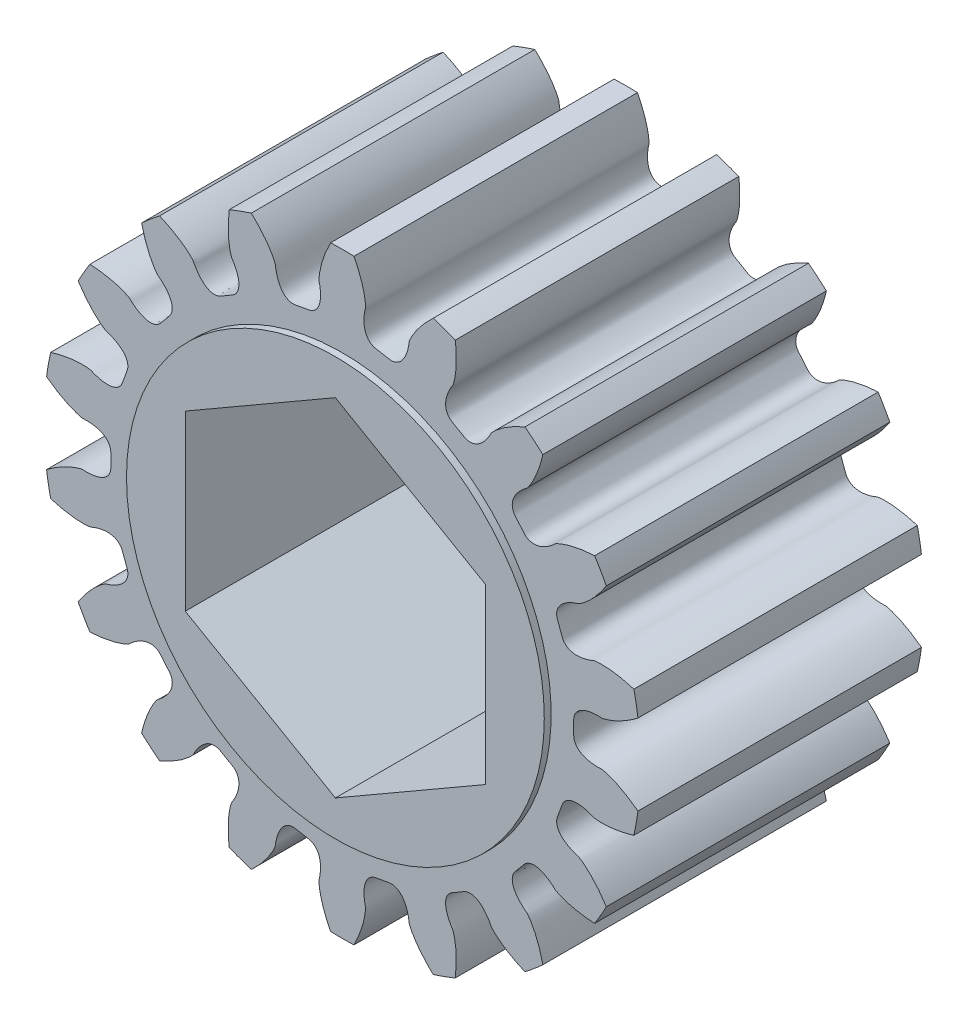
from build123d import *

# Parameters (mm, degrees)
BOSS_EXTRUDE1_DEPTH = 12.065
SKETCH2_R           = 8.89
BOSS_EXTRUDE2_DEPTH = 0.2921
BOSS_EXTRUDE3_START = 0.2921
SKETCH3_R           = 8.89
BOSS_EXTRUDE3_DEPTH = 0.2921
CUT_EXTRUDE1_DEPTH  = 22.900846166


with BuildPart() as part:
    # Sketch1 → Boss-Extrude1 (new body)
    with BuildSketch(Plane.XY.offset(6.0325)):
        with BuildLine():
            ThreePointArc((12.410970883, -2.694030306), (12.507058369, -2.205331838), (12.583910389, -1.713241638))
            add(Edge.make_bspline(
                [(12.583910389, -1.713241638), (12.454495513, -1.615266365), (12.281691884, -1.494600081), (12.063530587, -1.360821083), (11.945634884, -1.293014345), (11.833605036, -1.232708673), (11.727763905, -1.179517154), (11.628417021, -1.133040061), (11.535852234, -1.09286743), (11.450339429, -1.058575143), (11.372129731, -1.029740178), (11.301456539, -1.005894736), (11.238530851, -0.986673766), (11.183554417, -0.971362731), (11.126066888, -0.957744243), (11.037383924, -0.935500863), (10.935383555, -0.952855993), (10.832757273, -0.948980949), (10.755684694, -0.945835715), (10.681454151, -0.939599556), (10.609986165, -0.931080188), (10.541241018, -0.920104184), (10.475144099, -0.906715101), (10.411601978, -0.890856967), (10.350496087, -0.872438809), (10.291684118, -0.851296022), (10.23500406, -0.827170041), (10.180287123, -0.799673241), (10.127386898, -0.768246797), (10.076238411, -0.732113156), (10.026966573, -0.690238537), (9.98006979, -0.641341891), (9.936675165, -0.584030203), (9.898843597, -0.517153755), (9.869552788, -0.440522263), (9.854050846, -0.362318712), (9.847049326, -0.214546824), (9.861767648, -5e-09), (9.847049326, 0.214546814), (9.854050846, 0.362318702), (9.869552789, 0.440522252), (9.898843597, 0.517153744), (9.936675165, 0.584030193), (9.980069791, 0.641341881), (10.026966574, 0.690238527), (10.076238412, 0.732113146), (10.127386899, 0.768246787), (10.180287124, 0.79967323), (10.235004061, 0.82717003), (10.291684119, 0.851296011), (10.350496088, 0.872438798), (10.411601979, 0.890856956), (10.4751441, 0.90671509), (10.541241019, 0.920104174), (10.609986166, 0.931080178), (10.681454152, 0.939599545), (10.755684695, 0.945835704), (10.832757274, 0.948980938), (10.935383556, 0.952855982), (11.037383925, 0.935500852), (11.126066889, 0.957744232), (11.183554418, 0.97136272), (11.238530852, 0.986673755), (11.30145654, 1.005894724), (11.372129732, 1.029740166), (11.45033943, 1.058575132), (11.535852235, 1.092867418), (11.628417022, 1.133040049), (11.727763907, 1.179517142), (11.833605037, 1.23270866), (11.945634885, 1.293014333), (12.063530588, 1.360821071), (12.281691885, 1.494600068), (12.454495515, 1.615266353), (12.58391039, 1.713241625)],
                knots=[0, 0, 0, 0, 0.068568258, 0.088954796, 0.108105787, 0.12602123, 0.142701125, 0.158145472, 0.172354272, 0.185327523, 0.197065227, 0.207567384, 0.216833992, 0.224865053, 0.231660567, 0.241835881, 0.263155637, 0.274398239, 0.285253325, 0.295735543, 0.30586243, 0.315655123, 0.325139277, 0.334346238, 0.343314557, 0.352091904, 0.360737466, 0.369324816, 0.377945084, 0.386709838, 0.395752205, 0.405223204, 0.415278018, 0.42604547, 0.437577809, 0.44979349, 0.459544035, 0.500000005, 0.540455975, 0.550206519, 0.5624222, 0.573954539, 0.584721991, 0.594776805, 0.604247805, 0.613290172, 0.622054925, 0.630675194, 0.639262544, 0.647908106, 0.656685453, 0.665653771, 0.674860733, 0.684344886, 0.69413758, 0.704264467, 0.714746685, 0.725601771, 0.736844372, 0.758164128, 0.768339443, 0.775134956, 0.783166017, 0.792432626, 0.802934782, 0.814672486, 0.827645738, 0.841854537, 0.857298885, 0.87397878, 0.891894222, 0.911045213, 0.931431751, 1.000000005, 1.000000005, 1.000000005, 1.000000005], degree=3))
            ThreePointArc((12.58391039, 1.713241625), (12.507058371, 2.205331832), (12.410970883, 2.694030306))
            add(Edge.make_bspline(
                [(12.410970883, 2.694030306), (12.255851163, 2.741834452), (12.052198568, 2.796121347), (11.801438895, 2.847216926), (11.667461903, 2.870611712), (11.541562526, 2.888964043), (11.423911826, 2.902747921), (11.31466019, 2.912443467), (11.213937893, 2.91853437), (11.121853489, 2.921511477), (11.038498274, 2.921858189), (10.963931576, 2.92009392), (10.898226812, 2.91663387), (10.84132918, 2.912218489), (10.782650776, 2.905353789), (10.691708366, 2.895924368), (10.601795176, 2.8447297), (10.504032672, 2.813270795), (10.430532405, 2.789865973), (10.35864562, 2.770337704), (10.288573885, 2.7538998), (10.220220564, 2.740701645), (10.153530441, 2.730676791), (10.088396577, 2.723845877), (10.024676441, 2.720253838), (9.962180009, 2.720006681), (9.900666605, 2.723291966), (9.839845043, 2.730416211), (9.779386616, 2.741854465), (9.718964327, 2.758315169), (9.658341981, 2.780812478), (9.597549782, 2.810720651), (9.537170421, 2.849734185), (9.478747284, 2.899638332), (9.425013413, 2.961630333), (9.383699162, 3.029815656), (9.326578923, 3.166281147), (9.267030288, 3.372923173), (9.179820255, 3.569497273), (9.13585857, 3.710752086), (9.123678441, 3.789541362), (9.124993284, 3.871569456), (9.137670236, 3.94735192), (9.158846094, 4.016049126), (9.186191017, 4.078036588), (9.218169437, 4.13423782), (9.253874859, 4.185686149), (9.292836333, 4.233310288), (9.334848976, 4.277863123), (9.379859237, 4.319919851), (9.427893151, 4.359902449), (9.479014525, 4.398109302), (9.533300786, 4.434743759), (9.590832237, 4.46993186), (9.651677529, 4.503758155), (9.715921673, 4.536207233), (9.783542674, 4.567455646), (9.854891475, 4.596771573), (9.950003292, 4.63551318), (10.05178809, 4.654090873), (10.127515133, 4.705324173), (10.176877942, 4.737783259), (10.223302209, 4.770973973), (10.275859055, 4.810557629), (10.33411451, 4.85713667), (10.397745447, 4.910981967), (10.466372546, 4.972453278), (10.539615145, 5.041862224), (10.617074577, 5.119515041), (10.698340136, 5.205698517), (10.782988003, 5.300683777), (10.870582454, 5.404723974), (11.029831903, 5.605050669), (11.150943898, 5.777542208), (11.239044585, 5.913871343)],
                knots=[0, 0, 0, 0, 0.068568258, 0.088954796, 0.108105787, 0.12602123, 0.142701125, 0.158145472, 0.172354272, 0.185327523, 0.197065227, 0.207567384, 0.216833992, 0.224865053, 0.231660567, 0.241835881, 0.263155637, 0.274398239, 0.285253325, 0.295735543, 0.30586243, 0.315655123, 0.325139277, 0.334346238, 0.343314557, 0.352091904, 0.360737466, 0.369324816, 0.377945084, 0.386709838, 0.395752205, 0.405223204, 0.415278018, 0.42604547, 0.437577809, 0.44979349, 0.459544035, 0.500000005, 0.540455975, 0.550206519, 0.5624222, 0.573954539, 0.584721991, 0.594776805, 0.604247805, 0.613290172, 0.622054925, 0.630675194, 0.639262544, 0.647908106, 0.656685453, 0.665653771, 0.674860733, 0.684344886, 0.69413758, 0.704264467, 0.714746685, 0.725601771, 0.736844372, 0.758164128, 0.768339443, 0.775134956, 0.783166017, 0.792432626, 0.802934782, 0.814672486, 0.827645738, 0.841854537, 0.857298885, 0.87397878, 0.891894222, 0.911045213, 0.931431751, 1.000000005, 1.000000005, 1.000000005, 1.000000005], degree=3))
            ThreePointArc((11.239044585, 5.913871343), (10.998522549, 6.349999934), (10.741085127, 6.776362423))
            add(Edge.make_bspline(
                [(10.741085127, 6.776362423), (10.57897029, 6.768229557), (10.369032237, 6.749589262), (10.115919506, 6.711838541), (9.982020827, 6.687999619), (9.857437245, 6.662185046), (9.742167386, 6.634898745), (9.636188358, 6.606643318), (9.539457148, 6.57791784), (9.451907882, 6.549220684), (9.373461019, 6.521037324), (9.303994658, 6.493876141), (9.243435784, 6.468152405), (9.191479648, 6.444543168), (9.138687851, 6.418023263), (9.05645499, 6.378058371), (8.989473837, 6.299198996), (8.908366713, 6.23620055), (8.847303975, 6.189068639), (8.786431555, 6.146131341), (8.726207757, 6.106718819), (8.66649068, 6.070938398), (8.607251166, 6.03870875), (8.548381665, 6.010012697), (8.489732872, 5.984843715), (8.431089969, 5.963236424), (8.372162644, 5.945284759), (8.312572436, 5.931177161), (8.251847984, 5.921247604), (8.189439713, 5.916049966), (8.124778809, 5.916456458), (8.057423631, 5.92376879), (7.987342176, 5.939778563), (7.915374162, 5.966691232), (7.843678327, 6.006566591), (7.781534876, 6.05650953), (7.681185462, 6.165208873), (7.554552314, 6.339022027), (7.405369388, 6.49391367), (7.315746925, 6.611613994), (7.277353829, 6.681485846), (7.250534116, 6.759016743), (7.236527426, 6.834564738), (7.232930395, 6.906361566), (7.237425257, 6.97396324), (7.248253188, 7.037712387), (7.264208945, 7.098269976), (7.28453234, 7.156347637), (7.308773343, 7.212582777), (7.336684905, 7.26749759), (7.368147166, 7.321497509), (7.40311803, 7.374884747), (7.441600707, 7.42787687), (7.483627548, 7.480619784), (7.529234146, 7.533216419), (7.578505655, 7.58568137), (7.631361024, 7.638173018), (7.688380328, 7.690123705), (7.764505791, 7.759059064), (7.85379827, 7.811328837), (7.907435592, 7.885372565), (7.942719799, 7.932757203), (7.974992447, 7.979824307), (8.010841319, 8.034996277), (8.04965257, 8.098690797), (8.091029917, 8.171051887), (8.134493868, 8.252287874), (8.17958014, 8.342561393), (8.225809369, 8.442023858), (8.27269753, 8.550804293), (8.319753634, 8.669012516), (8.36648165, 8.796737388), (8.447611417, 9.039449425), (8.502423885, 9.242961193), (8.53858414, 9.401200885)],
                knots=[0, 0, 0, 0, 0.068568258, 0.088954796, 0.108105787, 0.12602123, 0.142701125, 0.158145472, 0.172354272, 0.185327523, 0.197065227, 0.207567384, 0.216833992, 0.224865053, 0.231660567, 0.241835881, 0.263155637, 0.274398239, 0.285253325, 0.295735543, 0.30586243, 0.315655123, 0.325139277, 0.334346238, 0.343314557, 0.352091904, 0.360737466, 0.369324816, 0.377945084, 0.386709838, 0.395752205, 0.405223204, 0.415278018, 0.42604547, 0.437577809, 0.44979349, 0.459544035, 0.500000005, 0.540455975, 0.550206519, 0.5624222, 0.573954539, 0.584721991, 0.594776805, 0.604247805, 0.613290172, 0.622054925, 0.630675194, 0.639262544, 0.647908106, 0.656685453, 0.665653771, 0.674860733, 0.684344886, 0.69413758, 0.704264467, 0.714746685, 0.725601771, 0.736844372, 0.758164128, 0.768339443, 0.775134956, 0.783166017, 0.792432626, 0.802934782, 0.814672486, 0.827645738, 0.841854537, 0.857298885, 0.87397878, 0.891894222, 0.911045213, 0.931431751, 1.000000005, 1.000000005, 1.000000005, 1.000000005], degree=3))
            ThreePointArc((8.53858414, 9.401200885), (8.163402594, 9.728764322), (7.775665989, 10.041365223))
            add(Edge.make_bspline(
                [(7.775665989, 10.041365223), (7.626109477, 9.978276289), (7.435207594, 9.888957098), (7.210270936, 9.766913371), (7.092600726, 9.698716067), (6.984359558, 9.631848209), (6.885373786, 9.56678286), (6.795450001, 9.503984481), (6.714377089, 9.443907339), (6.641922695, 9.386997221), (6.577846033, 9.333683118), (6.521858679, 9.28440106), (6.473749987, 9.2395163), (6.433002025, 9.199560829), (6.392464304, 9.156584413), (6.32885949, 9.090904403), (6.292889289, 8.993891927), (6.238220261, 8.906952482), (6.196960119, 8.841778287), (6.154444176, 8.780610831), (6.111332194, 8.722977423), (6.067454122, 8.668930382), (6.022810376, 8.618383312), (5.977305769, 8.571283288), (5.93080223, 8.527573113), (5.883086055, 8.487211847), (5.833852314, 8.450188467), (5.782680918, 8.41655061), (5.729014708, 8.386450893), (5.672147813, 8.360221825), (5.61124741, 8.338488471), (5.545453281, 8.322322988), (5.47412259, 8.313397984), (5.397290103, 8.31407311), (5.31627988, 8.327022271), (5.240802647, 8.352698971), (5.109327678, 8.42052142), (4.930883844, 8.54054127), (4.737721687, 8.635068239), (4.613248238, 8.715017677), (4.553272948, 8.767544528), (4.501553533, 8.831226859), (4.462552614, 8.897428182), (4.434616549, 8.963664873), (4.415719203, 9.028727002), (4.404090638, 9.092334975), (4.39837223, 9.154697685), (4.397606244, 9.216223845), (4.401151785, 9.277358502), (4.408598102, 9.338507863), (4.419693896, 9.400011916), (4.434296249, 9.462140249), (4.452333762, 9.525098407), (4.473786935, 9.58903456), (4.49865401, 9.654057605), (4.527010014, 9.720210381), (4.558724614, 9.787613996), (4.594537051, 9.855933424), (4.642494306, 9.946747914), (4.708524474, 10.02640526), (4.733602623, 10.114328649), (4.750552431, 10.170923554), (4.764780903, 10.22619006), (4.779597899, 10.290295789), (4.794283736, 10.363423289), (4.808416773, 10.445572357), (4.821475183, 10.536774762), (4.832967058, 10.637024535), (4.842390157, 10.746300007), (4.849245516, 10.864556874), (4.853034196, 10.991730405), (4.853259689, 11.127734447), (4.846484327, 11.383557171), (4.828386074, 11.593542647), (4.808244437, 11.754606853)],
                knots=[0, 0, 0, 0, 0.068568258, 0.088954796, 0.108105787, 0.12602123, 0.142701125, 0.158145472, 0.172354272, 0.185327523, 0.197065227, 0.207567384, 0.216833992, 0.224865053, 0.231660567, 0.241835881, 0.263155637, 0.274398239, 0.285253325, 0.295735543, 0.30586243, 0.315655123, 0.325139277, 0.334346238, 0.343314557, 0.352091904, 0.360737466, 0.369324816, 0.377945084, 0.386709838, 0.395752205, 0.405223204, 0.415278018, 0.42604547, 0.437577809, 0.44979349, 0.459544035, 0.500000005, 0.540455975, 0.550206519, 0.5624222, 0.573954539, 0.584721991, 0.594776805, 0.604247805, 0.613290172, 0.622054925, 0.630675194, 0.639262544, 0.647908106, 0.656685453, 0.665653771, 0.674860733, 0.684344886, 0.69413758, 0.704264467, 0.714746685, 0.725601771, 0.736844372, 0.758164128, 0.768339443, 0.775134956, 0.783166017, 0.792432626, 0.802934782, 0.814672486, 0.827645738, 0.841854537, 0.857298885, 0.87397878, 0.891894222, 0.911045213, 0.931431751, 1.000000005, 1.000000005, 1.000000005, 1.000000005], degree=3))
            ThreePointArc((4.808244437, 11.754606853), (4.343655813, 11.934096152), (3.872386782, 12.095231182))
            add(Edge.make_bspline(
                [(3.872386782, 12.095231182), (3.753427317, 11.984795637), (3.604587189, 11.835570763), (3.434957284, 11.643954305), (3.347708308, 11.53962422), (3.268865036, 11.439768327), (3.198102496, 11.344771771), (3.13508009, 11.255004851), (3.079444065, 11.170822235), (3.030823612, 11.092563355), (2.988845743, 11.020548977), (2.953090296, 10.955090188), (2.923234405, 10.896458169), (2.898609422, 10.844975684), (2.875215224, 10.790726345), (2.837910136, 10.707253197), (2.837289425, 10.603788756), (2.815652384, 10.503394492), (2.799171421, 10.428038982), (2.780140005, 10.356019066), (2.75933978, 10.287116212), (2.736593057, 10.221321422), (2.711929774, 10.158553653), (2.685278587, 10.098730616), (2.656529316, 10.04175134), (2.625495144, 9.987504263), (2.591893302, 9.935874735), (2.555312744, 9.886763841), (2.515177711, 9.840124434), (2.47071118, 9.796027549), (2.420916765, 9.754775711), (2.364619428, 9.717082209), (2.300643036, 9.684298916), (2.228213209, 9.658655068), (2.147659626, 9.643116171), (2.067952278, 9.641429642), (1.921209576, 9.66019481), (1.712478015, 9.711945192), (1.498634835, 9.734706138), (1.354323736, 9.767261608), (1.280000156, 9.796107945), (1.209619164, 9.83826068), (1.150328102, 9.887130474), (1.101422505, 9.939817908), (1.06141225, 9.994493037), (1.028729765, 10.050287777), (1.002026917, 10.106933744), (0.980263939, 10.16448744), (0.962686374, 10.223147873), (0.948769309, 10.283156266), (0.93816032, 10.344746156), (0.930632902, 10.408121991), (0.926049662, 10.4734525), (0.924341599, 10.540870249), (0.925469814, 10.610476965), (0.92949016, 10.682338565), (0.936238741, 10.756524276), (0.946524804, 10.832972114), (0.960529497, 10.934712167), (0.995333141, 11.032149235), (0.988827324, 11.123347427), (0.985398336, 11.182326417), (0.979866467, 11.239126369), (0.971864438, 11.30443376), (0.960653533, 11.378173985), (0.945837607, 11.460202641), (0.92691544, 11.550371108), (0.903426828, 11.648505532), (0.874907232, 11.754413776), (0.840902932, 11.867883553), (0.800967217, 11.988683386), (0.754662989, 12.116562504), (0.660799707, 12.35463992), (0.571973649, 12.545771754), (0.497959499, 12.690233755)],
                knots=[0, 0, 0, 0, 0.068568258, 0.088954796, 0.108105787, 0.12602123, 0.142701125, 0.158145472, 0.172354272, 0.185327523, 0.197065227, 0.207567384, 0.216833992, 0.224865053, 0.231660567, 0.241835881, 0.263155637, 0.274398239, 0.285253325, 0.295735543, 0.30586243, 0.315655123, 0.325139277, 0.334346238, 0.343314557, 0.352091904, 0.360737466, 0.369324816, 0.377945084, 0.386709838, 0.395752205, 0.405223204, 0.415278018, 0.42604547, 0.437577809, 0.44979349, 0.459544035, 0.500000005, 0.540455975, 0.550206519, 0.5624222, 0.573954539, 0.584721991, 0.594776805, 0.604247805, 0.613290172, 0.622054925, 0.630675194, 0.639262544, 0.647908106, 0.656685453, 0.665653771, 0.674860733, 0.684344886, 0.69413758, 0.704264467, 0.714746685, 0.725601771, 0.736844372, 0.758164128, 0.768339443, 0.775134956, 0.783166017, 0.792432626, 0.802934782, 0.814672486, 0.827645738, 0.841854537, 0.857298885, 0.87397878, 0.891894222, 0.911045213, 0.931431751, 1.000000005, 1.000000005, 1.000000005, 1.000000005], degree=3))
            ThreePointArc((0.497959499, 12.690233755), (4.2e-08, 12.699999857), (-0.497959416, 12.690233754))
            add(Edge.make_bspline(
                [(-0.497959416, 12.690233754), (-0.571973566, 12.545771754), (-0.660799623, 12.354639919), (-0.754662905, 12.116562503), (-0.800967133, 11.988683385), (-0.840902847, 11.867883552), (-0.874907148, 11.754413776), (-0.903426744, 11.648505531), (-0.926915355, 11.550371107), (-0.945837523, 11.46020264), (-0.960653449, 11.378173984), (-0.971864354, 11.304433759), (-0.979866382, 11.239126368), (-0.985398251, 11.182326416), (-0.988827239, 11.123347426), (-0.995333057, 11.032149233), (-0.960529412, 10.934712166), (-0.946524718, 10.832972113), (-0.936238656, 10.756524275), (-0.929490075, 10.682338564), (-0.925469729, 10.610476964), (-0.924341513, 10.540870248), (-0.926049577, 10.473452499), (-0.930632816, 10.40812199), (-0.938160235, 10.344746155), (-0.948769224, 10.283156265), (-0.962686288, 10.223147872), (-0.980263854, 10.164487439), (-1.002026831, 10.106933743), (-1.028729679, 10.050287776), (-1.061412164, 9.994493036), (-1.101422419, 9.939817907), (-1.150328016, 9.887130473), (-1.209619078, 9.838260679), (-1.28000007, 9.796107944), (-1.354323649, 9.767261607), (-1.498634749, 9.734706137), (-1.712477929, 9.71194519), (-1.92120949, 9.660194808), (-2.067952192, 9.64142964), (-2.147659539, 9.643116169), (-2.228213122, 9.658655066), (-2.30064295, 9.684298913), (-2.364619342, 9.717082207), (-2.420916679, 9.754775709), (-2.470711094, 9.796027546), (-2.515177625, 9.840124431), (-2.555312658, 9.886763838), (-2.591893216, 9.935874733), (-2.625495058, 9.987504261), (-2.65652923, 10.041751337), (-2.685278501, 10.098730613), (-2.711929688, 10.158553651), (-2.736592971, 10.221321419), (-2.759339694, 10.287116209), (-2.78013992, 10.356019063), (-2.799171336, 10.42803898), (-2.815652299, 10.503394489), (-2.837289339, 10.603788753), (-2.837910051, 10.707253194), (-2.875215139, 10.790726342), (-2.898609336, 10.844975681), (-2.92323432, 10.896458166), (-2.953090211, 10.955090185), (-2.988845658, 11.020548974), (-3.030823527, 11.092563352), (-3.07944398, 11.170822232), (-3.135080005, 11.255004848), (-3.198102412, 11.344771768), (-3.268864951, 11.439768323), (-3.347708224, 11.539624216), (-3.434957199, 11.643954302), (-3.604587105, 11.835570759), (-3.753427233, 11.984795633), (-3.872386698, 12.095231178)],
                knots=[0, 0, 0, 0, 0.068568258, 0.088954796, 0.108105787, 0.12602123, 0.142701125, 0.158145472, 0.172354272, 0.185327523, 0.197065227, 0.207567384, 0.216833992, 0.224865053, 0.231660567, 0.241835881, 0.263155637, 0.274398239, 0.285253325, 0.295735543, 0.30586243, 0.315655123, 0.325139277, 0.334346238, 0.343314557, 0.352091904, 0.360737466, 0.369324816, 0.377945084, 0.386709838, 0.395752205, 0.405223204, 0.415278018, 0.42604547, 0.437577809, 0.44979349, 0.459544035, 0.500000005, 0.540455975, 0.550206519, 0.5624222, 0.573954539, 0.584721991, 0.594776805, 0.604247805, 0.613290172, 0.622054925, 0.630675194, 0.639262544, 0.647908106, 0.656685453, 0.665653771, 0.674860733, 0.684344886, 0.69413758, 0.704264467, 0.714746685, 0.725601771, 0.736844372, 0.758164128, 0.768339443, 0.775134956, 0.783166017, 0.792432626, 0.802934782, 0.814672486, 0.827645738, 0.841854537, 0.857298885, 0.87397878, 0.891894222, 0.911045213, 0.931431751, 1.000000005, 1.000000005, 1.000000005, 1.000000005], degree=3))
            ThreePointArc((-3.872386698, 12.095231178), (-4.343655729, 11.934096147), (-4.808244353, 11.754606848))
            add(Edge.make_bspline(
                [(-4.808244353, 11.754606848), (-4.82838599, 11.593542642), (-4.846484243, 11.383557166), (-4.853259604, 11.127734442), (-4.853034111, 10.9917304), (-4.849245431, 10.864556869), (-4.842390072, 10.746300002), (-4.832966973, 10.63702453), (-4.821475098, 10.536774757), (-4.808416687, 10.445572352), (-4.794283651, 10.363423284), (-4.779597813, 10.290295784), (-4.764780817, 10.226190055), (-4.750552345, 10.170923549), (-4.733602538, 10.114328644), (-4.708524388, 10.026405255), (-4.64249422, 9.946747909), (-4.594536965, 9.855933419), (-4.558724527, 9.787613991), (-4.527009928, 9.720210376), (-4.498653924, 9.6540576), (-4.473786849, 9.589034555), (-4.452333676, 9.525098402), (-4.434296162, 9.462140244), (-4.419693809, 9.400011911), (-4.408598015, 9.338507859), (-4.401151699, 9.277358498), (-4.397606157, 9.21622384), (-4.398372143, 9.15469768), (-4.404090551, 9.092334971), (-4.415719116, 9.028726997), (-4.434616462, 8.963664869), (-4.462552527, 8.897428177), (-4.501553446, 8.831226854), (-4.553272861, 8.767544524), (-4.613248151, 8.715017672), (-4.7377216, 8.635068234), (-4.930883756, 8.540541265), (-5.109327591, 8.420521415), (-5.240802559, 8.352698965), (-5.316279792, 8.327022266), (-5.397290015, 8.314073104), (-5.474122503, 8.313397978), (-5.545453193, 8.322322982), (-5.611247322, 8.338488465), (-5.672147725, 8.360221819), (-5.72901462, 8.386450887), (-5.78268083, 8.416550604), (-5.833852226, 8.450188461), (-5.883085968, 8.487211841), (-5.930802143, 8.527573107), (-5.977305681, 8.571283282), (-6.022810289, 8.618383306), (-6.067454035, 8.668930375), (-6.111332106, 8.722977417), (-6.154444089, 8.780610824), (-6.196960032, 8.84177828), (-6.238220174, 8.906952475), (-6.292889201, 8.993891921), (-6.328859403, 9.090904397), (-6.392464217, 9.156584406), (-6.433001938, 9.199560823), (-6.4737499, 9.239516293), (-6.521858592, 9.284401053), (-6.577845946, 9.333683111), (-6.641922608, 9.386997214), (-6.714377002, 9.443907332), (-6.795449914, 9.503984474), (-6.8853737, 9.566782853), (-6.984359472, 9.631848201), (-7.09260064, 9.69871606), (-7.210270849, 9.766913364), (-7.435207508, 9.88895709), (-7.626109391, 9.978276281), (-7.775665903, 10.041365215)],
                knots=[0, 0, 0, 0, 0.068568258, 0.088954796, 0.108105787, 0.12602123, 0.142701125, 0.158145472, 0.172354272, 0.185327523, 0.197065227, 0.207567384, 0.216833992, 0.224865053, 0.231660567, 0.241835881, 0.263155637, 0.274398239, 0.285253325, 0.295735543, 0.30586243, 0.315655123, 0.325139277, 0.334346238, 0.343314557, 0.352091904, 0.360737466, 0.369324816, 0.377945084, 0.386709838, 0.395752205, 0.405223204, 0.415278018, 0.42604547, 0.437577809, 0.44979349, 0.459544035, 0.500000005, 0.540455975, 0.550206519, 0.5624222, 0.573954539, 0.584721991, 0.594776805, 0.604247805, 0.613290172, 0.622054925, 0.630675194, 0.639262544, 0.647908106, 0.656685453, 0.665653771, 0.674860733, 0.684344886, 0.69413758, 0.704264467, 0.714746685, 0.725601771, 0.736844372, 0.758164128, 0.768339443, 0.775134956, 0.783166017, 0.792432626, 0.802934782, 0.814672486, 0.827645738, 0.841854537, 0.857298885, 0.87397878, 0.891894222, 0.911045213, 0.931431751, 1.000000005, 1.000000005, 1.000000005, 1.000000005], degree=3))
            ThreePointArc((-7.775665903, 10.041365215), (-8.163402508, 9.728764314), (-8.538584053, 9.401200876))
            add(Edge.make_bspline(
                [(-8.538584053, 9.401200876), (-8.502423798, 9.242961184), (-8.44761133, 9.039449416), (-8.366481563, 8.79673738), (-8.319753546, 8.669012508), (-8.272697442, 8.550804284), (-8.225809282, 8.44202385), (-8.179580052, 8.342561384), (-8.13449378, 8.252287866), (-8.091029829, 8.171051878), (-8.049652482, 8.098690788), (-8.010841231, 8.034996268), (-7.974992359, 7.979824299), (-7.942719711, 7.932757195), (-7.907435504, 7.885372557), (-7.853798181, 7.811328829), (-7.764505703, 7.759059056), (-7.68838024, 7.690123697), (-7.631360936, 7.63817301), (-7.578505567, 7.585681362), (-7.529234057, 7.533216411), (-7.483627459, 7.480619776), (-7.441600618, 7.427876863), (-7.403117941, 7.374884739), (-7.368147077, 7.321497502), (-7.336684816, 7.267497582), (-7.308773254, 7.21258277), (-7.284532251, 7.15634763), (-7.264208856, 7.098269968), (-7.248253099, 7.03771238), (-7.237425168, 6.973963233), (-7.232930305, 6.906361558), (-7.236527337, 6.834564731), (-7.250534027, 6.759016736), (-7.277353739, 6.681485838), (-7.315746836, 6.611613986), (-7.405369299, 6.493913663), (-7.554552225, 6.339022019), (-7.681185372, 6.165208865), (-7.781534786, 6.056509522), (-7.843678237, 6.006566583), (-7.915374072, 5.966691223), (-7.987342086, 5.939778555), (-8.057423541, 5.923768782), (-8.124778719, 5.916456449), (-8.189439623, 5.916049957), (-8.251847894, 5.921247596), (-8.312572346, 5.931177152), (-8.372162554, 5.94528475), (-8.431089879, 5.963236416), (-8.489732782, 5.984843706), (-8.548381574, 6.010012688), (-8.607251076, 6.038708741), (-8.66649059, 6.070938389), (-8.726207667, 6.10671881), (-8.786431465, 6.146131332), (-8.847303885, 6.18906863), (-8.908366623, 6.236200541), (-8.989473747, 6.299198987), (-9.056454901, 6.378058361), (-9.138687761, 6.418023254), (-9.191479559, 6.444543158), (-9.243435694, 6.468152395), (-9.303994569, 6.493876131), (-9.373460929, 6.521037315), (-9.451907792, 6.549220675), (-9.539457058, 6.57791783), (-9.636188269, 6.606643308), (-9.742167297, 6.634898735), (-9.857437156, 6.662185035), (-9.982020738, 6.687999609), (-10.115919417, 6.71183853), (-10.369032148, 6.749589251), (-10.578970201, 6.768229546), (-10.741085038, 6.776362412)],
                knots=[0, 0, 0, 0, 0.068568258, 0.088954796, 0.108105787, 0.12602123, 0.142701125, 0.158145472, 0.172354272, 0.185327523, 0.197065227, 0.207567384, 0.216833992, 0.224865053, 0.231660567, 0.241835881, 0.263155637, 0.274398239, 0.285253325, 0.295735543, 0.30586243, 0.315655123, 0.325139277, 0.334346238, 0.343314557, 0.352091904, 0.360737466, 0.369324816, 0.377945084, 0.386709838, 0.395752205, 0.405223204, 0.415278018, 0.42604547, 0.437577809, 0.44979349, 0.459544035, 0.500000005, 0.540455975, 0.550206519, 0.5624222, 0.573954539, 0.584721991, 0.594776805, 0.604247805, 0.613290172, 0.622054925, 0.630675194, 0.639262544, 0.647908106, 0.656685453, 0.665653771, 0.674860733, 0.684344886, 0.69413758, 0.704264467, 0.714746685, 0.725601771, 0.736844372, 0.758164128, 0.768339443, 0.775134956, 0.783166017, 0.792432626, 0.802934782, 0.814672486, 0.827645738, 0.841854537, 0.857298885, 0.87397878, 0.891894222, 0.911045213, 0.931431751, 1.000000005, 1.000000005, 1.000000005, 1.000000005], degree=3))
            ThreePointArc((-10.741085038, 6.776362412), (-10.998522459, 6.349999923), (-11.239044495, 5.913871331))
            add(Edge.make_bspline(
                [(-11.239044495, 5.913871331), (-11.150943808, 5.777542197), (-11.029831812, 5.605050658), (-10.870582363, 5.404723963), (-10.782987912, 5.300683766), (-10.698340045, 5.205698506), (-10.617074486, 5.11951503), (-10.539615054, 5.041862213), (-10.466372455, 4.972453267), (-10.397745356, 4.910981956), (-10.334114419, 4.85713666), (-10.275858964, 4.810557619), (-10.223302118, 4.770973963), (-10.176877851, 4.737783248), (-10.127515041, 4.705324163), (-10.051787999, 4.654090863), (-9.950003201, 4.635513169), (-9.854891383, 4.596771563), (-9.783542583, 4.567455636), (-9.715921582, 4.536207223), (-9.651677437, 4.503758145), (-9.590832145, 4.46993185), (-9.533300694, 4.434743749), (-9.479014433, 4.398109293), (-9.427893059, 4.35990244), (-9.379859145, 4.319919841), (-9.334848884, 4.277863113), (-9.292836241, 4.233310278), (-9.253874767, 4.185686139), (-9.218169345, 4.13423781), (-9.186190925, 4.078036578), (-9.158846002, 4.016049116), (-9.137670144, 3.94735191), (-9.124993192, 3.871569447), (-9.123678349, 3.789541353), (-9.135858477, 3.710752077), (-9.179820163, 3.569497263), (-9.267030195, 3.372923163), (-9.32657883, 3.166281138), (-9.383699069, 3.029815646), (-9.42501332, 2.961630323), (-9.47874719, 2.899638322), (-9.537170328, 2.849734175), (-9.597549689, 2.810720641), (-9.658341887, 2.780812468), (-9.718964234, 2.758315159), (-9.779386522, 2.741854455), (-9.83984495, 2.730416201), (-9.900666511, 2.723291955), (-9.962179915, 2.720006671), (-10.024676347, 2.720253828), (-10.088396483, 2.723845866), (-10.153530347, 2.73067678), (-10.220220471, 2.740701635), (-10.288573792, 2.75389979), (-10.358645527, 2.770337694), (-10.430532312, 2.789865962), (-10.504032579, 2.813270784), (-10.601795082, 2.844729689), (-10.691708273, 2.895924358), (-10.782650683, 2.905353778), (-10.841329087, 2.912218478), (-10.898226719, 2.916633859), (-10.963931482, 2.920093908), (-11.03849818, 2.921858178), (-11.121853396, 2.921511465), (-11.2139378, 2.918534358), (-11.314660097, 2.912443455), (-11.423911733, 2.90274791), (-11.541562433, 2.888964031), (-11.667461809, 2.8706117), (-11.801438801, 2.847216914), (-12.052198474, 2.796121335), (-12.25585107, 2.74183444), (-12.41097079, 2.694030294)],
                knots=[0, 0, 0, 0, 0.068568258, 0.088954796, 0.108105787, 0.12602123, 0.142701125, 0.158145472, 0.172354272, 0.185327523, 0.197065227, 0.207567384, 0.216833992, 0.224865053, 0.231660567, 0.241835881, 0.263155637, 0.274398239, 0.285253325, 0.295735543, 0.30586243, 0.315655123, 0.325139277, 0.334346238, 0.343314557, 0.352091904, 0.360737466, 0.369324816, 0.377945084, 0.386709838, 0.395752205, 0.405223204, 0.415278018, 0.42604547, 0.437577809, 0.44979349, 0.459544035, 0.500000005, 0.540455975, 0.550206519, 0.5624222, 0.573954539, 0.584721991, 0.594776805, 0.604247805, 0.613290172, 0.622054925, 0.630675194, 0.639262544, 0.647908106, 0.656685453, 0.665653771, 0.674860733, 0.684344886, 0.69413758, 0.704264467, 0.714746685, 0.725601771, 0.736844372, 0.758164128, 0.768339443, 0.775134956, 0.783166017, 0.792432626, 0.802934782, 0.814672486, 0.827645738, 0.841854537, 0.857298885, 0.87397878, 0.891894222, 0.911045213, 0.931431751, 1.000000005, 1.000000005, 1.000000005, 1.000000005], degree=3))
            ThreePointArc((-12.41097079, 2.694030294), (-12.507058275, 2.205331828), (-12.583910293, 1.713241631))
            add(Edge.make_bspline(
                [(-12.583910293, 1.713241631), (-12.454495418, 1.615266359), (-12.281691788, 1.494600075), (-12.063530491, 1.360821077), (-11.945634789, 1.293014339), (-11.83360494, 1.232708667), (-11.72776381, 1.179517148), (-11.628416925, 1.133040055), (-11.535852138, 1.092867424), (-11.450339333, 1.058575137), (-11.372129635, 1.029740172), (-11.301456443, 1.00589473), (-11.238530755, 0.986673761), (-11.183554321, 0.971362725), (-11.126066792, 0.957744237), (-11.037383829, 0.935500858), (-10.93538346, 0.952855987), (-10.832757177, 0.948980943), (-10.755684598, 0.94583571), (-10.681454055, 0.939599551), (-10.609986069, 0.931080183), (-10.541240923, 0.920104179), (-10.475144003, 0.906715096), (-10.411601882, 0.890856962), (-10.350495991, 0.872438803), (-10.291684022, 0.851296017), (-10.235003964, 0.827170036), (-10.180287027, 0.799673236), (-10.127386802, 0.768246792), (-10.076238316, 0.732113151), (-10.026966477, 0.690238532), (-9.980069694, 0.641341886), (-9.936675069, 0.584030198), (-9.898843501, 0.51715375), (-9.869552692, 0.440522258), (-9.85405075, 0.362318707), (-9.84704923, 0.214546819), (-9.861767552, 0), (-9.84704923, -0.214546819), (-9.85405075, -0.362318707), (-9.869552692, -0.440522258), (-9.898843501, -0.51715375), (-9.936675069, -0.584030198), (-9.980069694, -0.641341886), (-10.026966477, -0.690238532), (-10.076238316, -0.732113151), (-10.127386802, -0.768246792), (-10.180287027, -0.799673236), (-10.235003964, -0.827170036), (-10.291684022, -0.851296017), (-10.350495991, -0.872438803), (-10.411601882, -0.890856962), (-10.475144003, -0.906715096), (-10.541240923, -0.920104179), (-10.609986069, -0.931080183), (-10.681454055, -0.939599551), (-10.755684598, -0.94583571), (-10.832757177, -0.948980943), (-10.93538346, -0.952855987), (-11.037383829, -0.935500858), (-11.126066792, -0.957744237), (-11.183554321, -0.971362725), (-11.238530755, -0.986673761), (-11.301456443, -1.00589473), (-11.372129635, -1.029740172), (-11.450339333, -1.058575137), (-11.535852138, -1.092867424), (-11.628416925, -1.133040055), (-11.72776381, -1.179517148), (-11.83360494, -1.232708667), (-11.945634789, -1.293014339), (-12.063530491, -1.360821077), (-12.281691788, -1.494600075), (-12.454495418, -1.615266359), (-12.583910293, -1.713241631)],
                knots=[0, 0, 0, 0, 0.068568258, 0.088954796, 0.108105787, 0.12602123, 0.142701125, 0.158145472, 0.172354272, 0.185327523, 0.197065227, 0.207567384, 0.216833992, 0.224865053, 0.231660567, 0.241835881, 0.263155637, 0.274398239, 0.285253325, 0.295735543, 0.30586243, 0.315655123, 0.325139277, 0.334346238, 0.343314557, 0.352091904, 0.360737466, 0.369324816, 0.377945084, 0.386709838, 0.395752205, 0.405223204, 0.415278018, 0.42604547, 0.437577809, 0.44979349, 0.459544035, 0.500000005, 0.540455975, 0.550206519, 0.5624222, 0.573954539, 0.584721991, 0.594776805, 0.604247805, 0.613290172, 0.622054925, 0.630675194, 0.639262544, 0.647908106, 0.656685453, 0.665653771, 0.674860733, 0.684344886, 0.69413758, 0.704264467, 0.714746685, 0.725601771, 0.736844372, 0.758164128, 0.768339443, 0.775134956, 0.783166017, 0.792432626, 0.802934782, 0.814672486, 0.827645738, 0.841854537, 0.857298885, 0.87397878, 0.891894222, 0.911045213, 0.931431751, 1.000000005, 1.000000005, 1.000000005, 1.000000005], degree=3))
            ThreePointArc((-12.583910293, -1.713241631), (-12.507058275, -2.205331828), (-12.41097079, -2.694030294))
            add(Edge.make_bspline(
                [(-12.41097079, -2.694030294), (-12.25585107, -2.74183444), (-12.052198474, -2.796121335), (-11.801438801, -2.847216914), (-11.667461809, -2.8706117), (-11.541562433, -2.888964031), (-11.423911733, -2.90274791), (-11.314660097, -2.912443455), (-11.2139378, -2.918534358), (-11.121853396, -2.921511465), (-11.03849818, -2.921858178), (-10.963931482, -2.920093908), (-10.898226719, -2.916633859), (-10.841329087, -2.912218478), (-10.782650683, -2.905353778), (-10.691708273, -2.895924358), (-10.601795082, -2.844729689), (-10.504032579, -2.813270784), (-10.430532312, -2.789865962), (-10.358645527, -2.770337694), (-10.288573792, -2.75389979), (-10.220220471, -2.740701635), (-10.153530347, -2.73067678), (-10.088396483, -2.723845866), (-10.024676347, -2.720253828), (-9.962179915, -2.720006671), (-9.900666511, -2.723291955), (-9.83984495, -2.730416201), (-9.779386522, -2.741854455), (-9.718964234, -2.758315159), (-9.658341887, -2.780812468), (-9.597549689, -2.810720641), (-9.537170328, -2.849734175), (-9.47874719, -2.899638322), (-9.42501332, -2.961630323), (-9.383699069, -3.029815646), (-9.32657883, -3.166281138), (-9.267030195, -3.372923163), (-9.179820163, -3.569497263), (-9.135858477, -3.710752077), (-9.123678349, -3.789541353), (-9.124993192, -3.871569447), (-9.137670144, -3.94735191), (-9.158846002, -4.016049116), (-9.186190925, -4.078036578), (-9.218169345, -4.13423781), (-9.253874767, -4.185686139), (-9.292836241, -4.233310278), (-9.334848884, -4.277863113), (-9.379859145, -4.319919841), (-9.427893059, -4.35990244), (-9.479014433, -4.398109293), (-9.533300694, -4.434743749), (-9.590832145, -4.46993185), (-9.651677437, -4.503758145), (-9.715921582, -4.536207223), (-9.783542583, -4.567455636), (-9.854891383, -4.596771563), (-9.950003201, -4.635513169), (-10.051787999, -4.654090863), (-10.127515041, -4.705324163), (-10.176877851, -4.737783248), (-10.223302118, -4.770973963), (-10.275858964, -4.810557619), (-10.334114419, -4.85713666), (-10.397745356, -4.910981956), (-10.466372455, -4.972453267), (-10.539615054, -5.041862213), (-10.617074486, -5.11951503), (-10.698340045, -5.205698506), (-10.782987912, -5.300683766), (-10.870582363, -5.404723963), (-11.029831812, -5.605050658), (-11.150943808, -5.777542197), (-11.239044495, -5.913871331)],
                knots=[0, 0, 0, 0, 0.068568258, 0.088954796, 0.108105787, 0.12602123, 0.142701125, 0.158145472, 0.172354272, 0.185327523, 0.197065227, 0.207567384, 0.216833992, 0.224865053, 0.231660567, 0.241835881, 0.263155637, 0.274398239, 0.285253325, 0.295735543, 0.30586243, 0.315655123, 0.325139277, 0.334346238, 0.343314557, 0.352091904, 0.360737466, 0.369324816, 0.377945084, 0.386709838, 0.395752205, 0.405223204, 0.415278018, 0.42604547, 0.437577809, 0.44979349, 0.459544035, 0.500000005, 0.540455975, 0.550206519, 0.5624222, 0.573954539, 0.584721991, 0.594776805, 0.604247805, 0.613290172, 0.622054925, 0.630675194, 0.639262544, 0.647908106, 0.656685453, 0.665653771, 0.674860733, 0.684344886, 0.69413758, 0.704264467, 0.714746685, 0.725601771, 0.736844372, 0.758164128, 0.768339443, 0.775134956, 0.783166017, 0.792432626, 0.802934782, 0.814672486, 0.827645738, 0.841854537, 0.857298885, 0.87397878, 0.891894222, 0.911045213, 0.931431751, 1.000000005, 1.000000005, 1.000000005, 1.000000005], degree=3))
            ThreePointArc((-11.239044495, -5.913871331), (-10.998522459, -6.349999923), (-10.741085038, -6.776362412))
            add(Edge.make_bspline(
                [(-10.741085038, -6.776362412), (-10.578970201, -6.768229546), (-10.369032148, -6.749589251), (-10.115919417, -6.71183853), (-9.982020738, -6.687999609), (-9.857437156, -6.662185035), (-9.742167297, -6.634898735), (-9.636188269, -6.606643308), (-9.539457058, -6.57791783), (-9.451907792, -6.549220675), (-9.373460929, -6.521037315), (-9.303994569, -6.493876131), (-9.243435694, -6.468152395), (-9.191479559, -6.444543158), (-9.138687761, -6.418023254), (-9.056454901, -6.378058361), (-8.989473747, -6.299198987), (-8.908366623, -6.236200541), (-8.847303885, -6.18906863), (-8.786431465, -6.146131332), (-8.726207667, -6.10671881), (-8.66649059, -6.070938389), (-8.607251076, -6.038708741), (-8.548381574, -6.010012688), (-8.489732782, -5.984843706), (-8.431089879, -5.963236416), (-8.372162554, -5.94528475), (-8.312572346, -5.931177152), (-8.251847894, -5.921247596), (-8.189439623, -5.916049957), (-8.124778719, -5.916456449), (-8.057423541, -5.923768782), (-7.987342086, -5.939778555), (-7.915374072, -5.966691223), (-7.843678237, -6.006566583), (-7.781534786, -6.056509522), (-7.681185372, -6.165208865), (-7.554552225, -6.339022019), (-7.405369299, -6.493913663), (-7.315746836, -6.611613986), (-7.277353739, -6.681485838), (-7.250534027, -6.759016736), (-7.236527337, -6.834564731), (-7.232930305, -6.906361558), (-7.237425168, -6.973963233), (-7.248253099, -7.03771238), (-7.264208856, -7.098269968), (-7.284532251, -7.15634763), (-7.308773254, -7.21258277), (-7.336684816, -7.267497582), (-7.368147077, -7.321497502), (-7.403117941, -7.374884739), (-7.441600618, -7.427876863), (-7.483627459, -7.480619776), (-7.529234057, -7.533216411), (-7.578505567, -7.585681362), (-7.631360936, -7.63817301), (-7.68838024, -7.690123697), (-7.764505703, -7.759059056), (-7.853798181, -7.811328829), (-7.907435504, -7.885372557), (-7.942719711, -7.932757195), (-7.974992359, -7.979824299), (-8.010841231, -8.034996268), (-8.049652482, -8.098690788), (-8.091029829, -8.171051878), (-8.13449378, -8.252287866), (-8.179580052, -8.342561384), (-8.225809282, -8.44202385), (-8.272697442, -8.550804284), (-8.319753546, -8.669012508), (-8.366481563, -8.79673738), (-8.44761133, -9.039449416), (-8.502423798, -9.242961184), (-8.538584053, -9.401200876)],
                knots=[0, 0, 0, 0, 0.068568258, 0.088954796, 0.108105787, 0.12602123, 0.142701125, 0.158145472, 0.172354272, 0.185327523, 0.197065227, 0.207567384, 0.216833992, 0.224865053, 0.231660567, 0.241835881, 0.263155637, 0.274398239, 0.285253325, 0.295735543, 0.30586243, 0.315655123, 0.325139277, 0.334346238, 0.343314557, 0.352091904, 0.360737466, 0.369324816, 0.377945084, 0.386709838, 0.395752205, 0.405223204, 0.415278018, 0.42604547, 0.437577809, 0.44979349, 0.459544035, 0.500000005, 0.540455975, 0.550206519, 0.5624222, 0.573954539, 0.584721991, 0.594776805, 0.604247805, 0.613290172, 0.622054925, 0.630675194, 0.639262544, 0.647908106, 0.656685453, 0.665653771, 0.674860733, 0.684344886, 0.69413758, 0.704264467, 0.714746685, 0.725601771, 0.736844372, 0.758164128, 0.768339443, 0.775134956, 0.783166017, 0.792432626, 0.802934782, 0.814672486, 0.827645738, 0.841854537, 0.857298885, 0.87397878, 0.891894222, 0.911045213, 0.931431751, 1.000000005, 1.000000005, 1.000000005, 1.000000005], degree=3))
            ThreePointArc((-8.538584053, -9.401200876), (-8.163402508, -9.728764314), (-7.775665903, -10.041365215))
            add(Edge.make_bspline(
                [(-7.775665903, -10.041365215), (-7.626109391, -9.978276281), (-7.435207508, -9.88895709), (-7.210270849, -9.766913364), (-7.09260064, -9.69871606), (-6.984359472, -9.631848201), (-6.8853737, -9.566782853), (-6.795449914, -9.503984474), (-6.714377002, -9.443907332), (-6.641922608, -9.386997214), (-6.577845946, -9.333683111), (-6.521858592, -9.284401053), (-6.4737499, -9.239516293), (-6.433001938, -9.199560823), (-6.392464217, -9.156584406), (-6.328859403, -9.090904397), (-6.292889201, -8.993891921), (-6.238220174, -8.906952475), (-6.196960032, -8.84177828), (-6.154444089, -8.780610824), (-6.111332106, -8.722977417), (-6.067454035, -8.668930375), (-6.022810289, -8.618383306), (-5.977305681, -8.571283282), (-5.930802143, -8.527573107), (-5.883085968, -8.487211841), (-5.833852226, -8.450188461), (-5.78268083, -8.416550604), (-5.72901462, -8.386450887), (-5.672147725, -8.360221819), (-5.611247322, -8.338488465), (-5.545453193, -8.322322982), (-5.474122503, -8.313397978), (-5.397290015, -8.314073104), (-5.316279792, -8.327022266), (-5.240802559, -8.352698965), (-5.109327591, -8.420521415), (-4.930883756, -8.540541265), (-4.7377216, -8.635068234), (-4.613248151, -8.715017672), (-4.553272861, -8.767544524), (-4.501553446, -8.831226854), (-4.462552527, -8.897428177), (-4.434616462, -8.963664869), (-4.415719116, -9.028726997), (-4.404090551, -9.092334971), (-4.398372143, -9.15469768), (-4.397606157, -9.21622384), (-4.401151699, -9.277358498), (-4.408598015, -9.338507859), (-4.419693809, -9.400011911), (-4.434296162, -9.462140244), (-4.452333676, -9.525098402), (-4.473786849, -9.589034555), (-4.498653924, -9.6540576), (-4.527009928, -9.720210376), (-4.558724527, -9.787613991), (-4.594536965, -9.855933419), (-4.64249422, -9.946747909), (-4.708524388, -10.026405255), (-4.733602538, -10.114328644), (-4.750552345, -10.170923549), (-4.764780817, -10.226190055), (-4.779597813, -10.290295784), (-4.794283651, -10.363423284), (-4.808416687, -10.445572352), (-4.821475098, -10.536774757), (-4.832966973, -10.63702453), (-4.842390072, -10.746300002), (-4.849245431, -10.864556869), (-4.853034111, -10.9917304), (-4.853259604, -11.127734442), (-4.846484243, -11.383557166), (-4.82838599, -11.593542642), (-4.808244353, -11.754606848)],
                knots=[0, 0, 0, 0, 0.068568258, 0.088954796, 0.108105787, 0.12602123, 0.142701125, 0.158145472, 0.172354272, 0.185327523, 0.197065227, 0.207567384, 0.216833992, 0.224865053, 0.231660567, 0.241835881, 0.263155637, 0.274398239, 0.285253325, 0.295735543, 0.30586243, 0.315655123, 0.325139277, 0.334346238, 0.343314557, 0.352091904, 0.360737466, 0.369324816, 0.377945084, 0.386709838, 0.395752205, 0.405223204, 0.415278018, 0.42604547, 0.437577809, 0.44979349, 0.459544035, 0.500000005, 0.540455975, 0.550206519, 0.5624222, 0.573954539, 0.584721991, 0.594776805, 0.604247805, 0.613290172, 0.622054925, 0.630675194, 0.639262544, 0.647908106, 0.656685453, 0.665653771, 0.674860733, 0.684344886, 0.69413758, 0.704264467, 0.714746685, 0.725601771, 0.736844372, 0.758164128, 0.768339443, 0.775134956, 0.783166017, 0.792432626, 0.802934782, 0.814672486, 0.827645738, 0.841854537, 0.857298885, 0.87397878, 0.891894222, 0.911045213, 0.931431751, 1.000000005, 1.000000005, 1.000000005, 1.000000005], degree=3))
            ThreePointArc((-4.808244353, -11.754606848), (-4.343655729, -11.934096147), (-3.872386698, -12.095231178))
            add(Edge.make_bspline(
                [(-3.872386698, -12.095231178), (-3.753427233, -11.984795633), (-3.604587105, -11.835570759), (-3.434957199, -11.643954302), (-3.347708224, -11.539624216), (-3.268864951, -11.439768323), (-3.198102412, -11.344771768), (-3.135080005, -11.255004848), (-3.07944398, -11.170822232), (-3.030823527, -11.092563352), (-2.988845658, -11.020548974), (-2.953090211, -10.955090185), (-2.92323432, -10.896458166), (-2.898609336, -10.844975681), (-2.875215139, -10.790726342), (-2.837910051, -10.707253194), (-2.837289339, -10.603788753), (-2.815652299, -10.503394489), (-2.799171336, -10.42803898), (-2.78013992, -10.356019063), (-2.759339694, -10.287116209), (-2.736592971, -10.221321419), (-2.711929688, -10.158553651), (-2.685278501, -10.098730613), (-2.65652923, -10.041751337), (-2.625495058, -9.987504261), (-2.591893216, -9.935874733), (-2.555312658, -9.886763838), (-2.515177625, -9.840124431), (-2.470711094, -9.796027546), (-2.420916679, -9.754775709), (-2.364619342, -9.717082207), (-2.30064295, -9.684298913), (-2.228213122, -9.658655066), (-2.147659539, -9.643116169), (-2.067952192, -9.64142964), (-1.92120949, -9.660194808), (-1.712477929, -9.71194519), (-1.498634749, -9.734706137), (-1.354323649, -9.767261607), (-1.28000007, -9.796107944), (-1.209619078, -9.838260679), (-1.150328016, -9.887130473), (-1.101422419, -9.939817907), (-1.061412164, -9.994493036), (-1.028729679, -10.050287776), (-1.002026831, -10.106933743), (-0.980263854, -10.164487439), (-0.962686288, -10.223147872), (-0.948769224, -10.283156265), (-0.938160235, -10.344746155), (-0.930632816, -10.40812199), (-0.926049577, -10.473452499), (-0.924341513, -10.540870248), (-0.925469729, -10.610476964), (-0.929490075, -10.682338564), (-0.936238656, -10.756524275), (-0.946524718, -10.832972113), (-0.960529412, -10.934712166), (-0.995333057, -11.032149233), (-0.988827239, -11.123347426), (-0.985398251, -11.182326416), (-0.979866382, -11.239126368), (-0.971864354, -11.304433759), (-0.960653449, -11.378173984), (-0.945837523, -11.46020264), (-0.926915355, -11.550371107), (-0.903426744, -11.648505531), (-0.874907148, -11.754413776), (-0.840902847, -11.867883552), (-0.800967133, -11.988683385), (-0.754662905, -12.116562503), (-0.660799623, -12.354639919), (-0.571973566, -12.545771754), (-0.497959416, -12.690233754)],
                knots=[0, 0, 0, 0, 0.068568258, 0.088954796, 0.108105787, 0.12602123, 0.142701125, 0.158145472, 0.172354272, 0.185327523, 0.197065227, 0.207567384, 0.216833992, 0.224865053, 0.231660567, 0.241835881, 0.263155637, 0.274398239, 0.285253325, 0.295735543, 0.30586243, 0.315655123, 0.325139277, 0.334346238, 0.343314557, 0.352091904, 0.360737466, 0.369324816, 0.377945084, 0.386709838, 0.395752205, 0.405223204, 0.415278018, 0.42604547, 0.437577809, 0.44979349, 0.459544035, 0.500000005, 0.540455975, 0.550206519, 0.5624222, 0.573954539, 0.584721991, 0.594776805, 0.604247805, 0.613290172, 0.622054925, 0.630675194, 0.639262544, 0.647908106, 0.656685453, 0.665653771, 0.674860733, 0.684344886, 0.69413758, 0.704264467, 0.714746685, 0.725601771, 0.736844372, 0.758164128, 0.768339443, 0.775134956, 0.783166017, 0.792432626, 0.802934782, 0.814672486, 0.827645738, 0.841854537, 0.857298885, 0.87397878, 0.891894222, 0.911045213, 0.931431751, 1.000000005, 1.000000005, 1.000000005, 1.000000005], degree=3))
            ThreePointArc((-0.497959416, -12.690233754), (4.2e-08, -12.699999857), (0.497959499, -12.690233755))
            add(Edge.make_bspline(
                [(0.497959499, -12.690233755), (0.571973649, -12.545771754), (0.660799707, -12.35463992), (0.754662989, -12.116562504), (0.800967217, -11.988683386), (0.840902932, -11.867883553), (0.874907232, -11.754413776), (0.903426828, -11.648505532), (0.92691544, -11.550371108), (0.945837607, -11.460202641), (0.960653533, -11.378173985), (0.971864438, -11.30443376), (0.979866467, -11.239126369), (0.985398336, -11.182326417), (0.988827324, -11.123347427), (0.995333141, -11.032149235), (0.960529497, -10.934712167), (0.946524804, -10.832972114), (0.936238741, -10.756524276), (0.92949016, -10.682338565), (0.925469814, -10.610476965), (0.924341599, -10.540870249), (0.926049662, -10.4734525), (0.930632902, -10.408121991), (0.93816032, -10.344746156), (0.948769309, -10.283156266), (0.962686374, -10.223147873), (0.980263939, -10.16448744), (1.002026917, -10.106933744), (1.028729765, -10.050287777), (1.06141225, -9.994493037), (1.101422505, -9.939817908), (1.150328102, -9.887130474), (1.209619164, -9.83826068), (1.280000156, -9.796107945), (1.354323736, -9.767261608), (1.498634835, -9.734706138), (1.712478015, -9.711945192), (1.921209576, -9.66019481), (2.067952278, -9.641429642), (2.147659626, -9.643116171), (2.228213209, -9.658655068), (2.300643036, -9.684298916), (2.364619428, -9.717082209), (2.420916765, -9.754775711), (2.47071118, -9.796027549), (2.515177711, -9.840124434), (2.555312744, -9.886763841), (2.591893302, -9.935874735), (2.625495144, -9.987504263), (2.656529316, -10.04175134), (2.685278587, -10.098730616), (2.711929774, -10.158553653), (2.736593057, -10.221321422), (2.75933978, -10.287116212), (2.780140005, -10.356019066), (2.799171421, -10.428038982), (2.815652384, -10.503394492), (2.837289425, -10.603788756), (2.837910136, -10.707253197), (2.875215224, -10.790726345), (2.898609422, -10.844975684), (2.923234405, -10.896458169), (2.953090296, -10.955090188), (2.988845743, -11.020548977), (3.030823612, -11.092563355), (3.079444065, -11.170822235), (3.13508009, -11.255004851), (3.198102496, -11.344771771), (3.268865036, -11.439768327), (3.347708308, -11.53962422), (3.434957284, -11.643954305), (3.604587189, -11.835570763), (3.753427317, -11.984795637), (3.872386782, -12.095231182)],
                knots=[0, 0, 0, 0, 0.068568258, 0.088954796, 0.108105787, 0.12602123, 0.142701125, 0.158145472, 0.172354272, 0.185327523, 0.197065227, 0.207567384, 0.216833992, 0.224865053, 0.231660567, 0.241835881, 0.263155637, 0.274398239, 0.285253325, 0.295735543, 0.30586243, 0.315655123, 0.325139277, 0.334346238, 0.343314557, 0.352091904, 0.360737466, 0.369324816, 0.377945084, 0.386709838, 0.395752205, 0.405223204, 0.415278018, 0.42604547, 0.437577809, 0.44979349, 0.459544035, 0.500000005, 0.540455975, 0.550206519, 0.5624222, 0.573954539, 0.584721991, 0.594776805, 0.604247805, 0.613290172, 0.622054925, 0.630675194, 0.639262544, 0.647908106, 0.656685453, 0.665653771, 0.674860733, 0.684344886, 0.69413758, 0.704264467, 0.714746685, 0.725601771, 0.736844372, 0.758164128, 0.768339443, 0.775134956, 0.783166017, 0.792432626, 0.802934782, 0.814672486, 0.827645738, 0.841854537, 0.857298885, 0.87397878, 0.891894222, 0.911045213, 0.931431751, 1.000000005, 1.000000005, 1.000000005, 1.000000005], degree=3))
            ThreePointArc((3.872386782, -12.095231182), (4.343655813, -11.934096152), (4.808244437, -11.754606853))
            add(Edge.make_bspline(
                [(4.808244437, -11.754606853), (4.828386074, -11.593542647), (4.846484327, -11.383557171), (4.853259689, -11.127734447), (4.853034196, -10.991730405), (4.849245516, -10.864556874), (4.842390157, -10.746300007), (4.832967058, -10.637024535), (4.821475183, -10.536774762), (4.808416773, -10.445572357), (4.794283736, -10.363423289), (4.779597899, -10.290295789), (4.764780903, -10.22619006), (4.750552431, -10.170923554), (4.733602623, -10.114328649), (4.708524474, -10.02640526), (4.642494306, -9.946747914), (4.594537051, -9.855933424), (4.558724614, -9.787613996), (4.527010014, -9.720210381), (4.49865401, -9.654057605), (4.473786935, -9.58903456), (4.452333762, -9.525098407), (4.434296249, -9.462140249), (4.419693896, -9.400011916), (4.408598102, -9.338507863), (4.401151785, -9.277358502), (4.397606244, -9.216223845), (4.39837223, -9.154697685), (4.404090638, -9.092334975), (4.415719203, -9.028727002), (4.434616549, -8.963664873), (4.462552614, -8.897428182), (4.501553533, -8.831226859), (4.553272948, -8.767544528), (4.613248238, -8.715017677), (4.737721687, -8.635068239), (4.930883844, -8.54054127), (5.109327678, -8.42052142), (5.240802647, -8.352698971), (5.31627988, -8.327022271), (5.397290103, -8.31407311), (5.47412259, -8.313397984), (5.545453281, -8.322322988), (5.61124741, -8.338488471), (5.672147813, -8.360221825), (5.729014708, -8.386450893), (5.782680918, -8.41655061), (5.833852314, -8.450188467), (5.883086055, -8.487211847), (5.93080223, -8.527573113), (5.977305769, -8.571283288), (6.022810376, -8.618383312), (6.067454122, -8.668930382), (6.111332194, -8.722977423), (6.154444176, -8.780610831), (6.196960119, -8.841778287), (6.238220261, -8.906952482), (6.292889289, -8.993891927), (6.32885949, -9.090904403), (6.392464304, -9.156584413), (6.433002025, -9.199560829), (6.473749987, -9.2395163), (6.521858679, -9.28440106), (6.577846033, -9.333683118), (6.641922695, -9.386997221), (6.714377089, -9.443907339), (6.795450001, -9.503984481), (6.885373786, -9.56678286), (6.984359558, -9.631848209), (7.092600726, -9.698716067), (7.210270936, -9.766913371), (7.435207594, -9.888957098), (7.626109477, -9.978276289), (7.775665989, -10.041365223)],
                knots=[0, 0, 0, 0, 0.068568258, 0.088954796, 0.108105787, 0.12602123, 0.142701125, 0.158145472, 0.172354272, 0.185327523, 0.197065227, 0.207567384, 0.216833992, 0.224865053, 0.231660567, 0.241835881, 0.263155637, 0.274398239, 0.285253325, 0.295735543, 0.30586243, 0.315655123, 0.325139277, 0.334346238, 0.343314557, 0.352091904, 0.360737466, 0.369324816, 0.377945084, 0.386709838, 0.395752205, 0.405223204, 0.415278018, 0.42604547, 0.437577809, 0.44979349, 0.459544035, 0.500000005, 0.540455975, 0.550206519, 0.5624222, 0.573954539, 0.584721991, 0.594776805, 0.604247805, 0.613290172, 0.622054925, 0.630675194, 0.639262544, 0.647908106, 0.656685453, 0.665653771, 0.674860733, 0.684344886, 0.69413758, 0.704264467, 0.714746685, 0.725601771, 0.736844372, 0.758164128, 0.768339443, 0.775134956, 0.783166017, 0.792432626, 0.802934782, 0.814672486, 0.827645738, 0.841854537, 0.857298885, 0.87397878, 0.891894222, 0.911045213, 0.931431751, 1.000000005, 1.000000005, 1.000000005, 1.000000005], degree=3))
            ThreePointArc((7.775665989, -10.041365223), (8.163402594, -9.728764322), (8.53858414, -9.401200885))
            add(Edge.make_bspline(
                [(8.53858414, -9.401200885), (8.502423885, -9.242961193), (8.447611417, -9.039449425), (8.36648165, -8.796737388), (8.319753634, -8.669012516), (8.27269753, -8.550804293), (8.225809369, -8.442023858), (8.17958014, -8.342561393), (8.134493868, -8.252287874), (8.091029917, -8.171051887), (8.04965257, -8.098690797), (8.010841319, -8.034996277), (7.974992447, -7.979824307), (7.942719799, -7.932757203), (7.907435592, -7.885372565), (7.85379827, -7.811328837), (7.764505791, -7.759059064), (7.688380328, -7.690123705), (7.631361024, -7.638173018), (7.578505655, -7.58568137), (7.529234146, -7.533216419), (7.483627548, -7.480619784), (7.441600707, -7.42787687), (7.40311803, -7.374884747), (7.368147166, -7.321497509), (7.336684905, -7.26749759), (7.308773343, -7.212582777), (7.28453234, -7.156347637), (7.264208945, -7.098269976), (7.248253188, -7.037712387), (7.237425257, -6.97396324), (7.232930395, -6.906361566), (7.236527426, -6.834564738), (7.250534116, -6.759016743), (7.277353829, -6.681485846), (7.315746925, -6.611613994), (7.405369388, -6.49391367), (7.554552314, -6.339022027), (7.681185462, -6.165208873), (7.781534876, -6.05650953), (7.843678327, -6.006566591), (7.915374162, -5.966691232), (7.987342176, -5.939778563), (8.057423631, -5.92376879), (8.124778809, -5.916456458), (8.189439713, -5.916049966), (8.251847984, -5.921247604), (8.312572436, -5.931177161), (8.372162644, -5.945284759), (8.431089969, -5.963236424), (8.489732872, -5.984843715), (8.548381665, -6.010012697), (8.607251166, -6.03870875), (8.66649068, -6.070938398), (8.726207757, -6.106718819), (8.786431555, -6.146131341), (8.847303975, -6.189068639), (8.908366713, -6.23620055), (8.989473837, -6.299198996), (9.05645499, -6.378058371), (9.138687851, -6.418023263), (9.191479648, -6.444543168), (9.243435784, -6.468152405), (9.303994658, -6.493876141), (9.373461019, -6.521037324), (9.451907882, -6.549220684), (9.539457148, -6.57791784), (9.636188358, -6.606643318), (9.742167386, -6.634898745), (9.857437245, -6.662185046), (9.982020827, -6.687999619), (10.115919506, -6.711838541), (10.369032237, -6.749589262), (10.57897029, -6.768229557), (10.741085127, -6.776362423)],
                knots=[0, 0, 0, 0, 0.068568258, 0.088954796, 0.108105787, 0.12602123, 0.142701125, 0.158145472, 0.172354272, 0.185327523, 0.197065227, 0.207567384, 0.216833992, 0.224865053, 0.231660567, 0.241835881, 0.263155637, 0.274398239, 0.285253325, 0.295735543, 0.30586243, 0.315655123, 0.325139277, 0.334346238, 0.343314557, 0.352091904, 0.360737466, 0.369324816, 0.377945084, 0.386709838, 0.395752205, 0.405223204, 0.415278018, 0.42604547, 0.437577809, 0.44979349, 0.459544035, 0.500000005, 0.540455975, 0.550206519, 0.5624222, 0.573954539, 0.584721991, 0.594776805, 0.604247805, 0.613290172, 0.622054925, 0.630675194, 0.639262544, 0.647908106, 0.656685453, 0.665653771, 0.674860733, 0.684344886, 0.69413758, 0.704264467, 0.714746685, 0.725601771, 0.736844372, 0.758164128, 0.768339443, 0.775134956, 0.783166017, 0.792432626, 0.802934782, 0.814672486, 0.827645738, 0.841854537, 0.857298885, 0.87397878, 0.891894222, 0.911045213, 0.931431751, 1.000000005, 1.000000005, 1.000000005, 1.000000005], degree=3))
            ThreePointArc((10.741085127, -6.776362423), (10.998522549, -6.349999934), (11.239044585, -5.913871343))
            add(Edge.make_bspline(
                [(11.239044585, -5.913871343), (11.150943898, -5.777542208), (11.029831903, -5.605050669), (10.870582454, -5.404723974), (10.782988003, -5.300683777), (10.698340136, -5.205698517), (10.617074577, -5.119515041), (10.539615145, -5.041862224), (10.466372546, -4.972453278), (10.397745447, -4.910981967), (10.33411451, -4.85713667), (10.275859055, -4.810557629), (10.223302209, -4.770973973), (10.176877942, -4.737783259), (10.127515133, -4.705324173), (10.05178809, -4.654090873), (9.950003292, -4.63551318), (9.854891475, -4.596771573), (9.783542674, -4.567455646), (9.715921673, -4.536207233), (9.651677529, -4.503758155), (9.590832237, -4.46993186), (9.533300786, -4.434743759), (9.479014525, -4.398109302), (9.427893151, -4.359902449), (9.379859237, -4.319919851), (9.334848976, -4.277863123), (9.292836333, -4.233310288), (9.253874859, -4.185686149), (9.218169437, -4.13423782), (9.186191017, -4.078036588), (9.158846094, -4.016049126), (9.137670236, -3.94735192), (9.124993284, -3.871569456), (9.123678441, -3.789541362), (9.13585857, -3.710752086), (9.179820255, -3.569497273), (9.267030288, -3.372923173), (9.326578923, -3.166281147), (9.383699162, -3.029815656), (9.425013413, -2.961630333), (9.478747284, -2.899638332), (9.537170421, -2.849734185), (9.597549782, -2.810720651), (9.658341981, -2.780812478), (9.718964327, -2.758315169), (9.779386616, -2.741854465), (9.839845043, -2.730416211), (9.900666605, -2.723291966), (9.962180009, -2.720006681), (10.024676441, -2.720253838), (10.088396577, -2.723845877), (10.153530441, -2.730676791), (10.220220564, -2.740701645), (10.288573885, -2.7538998), (10.35864562, -2.770337704), (10.430532405, -2.789865973), (10.504032672, -2.813270795), (10.601795176, -2.8447297), (10.691708366, -2.895924368), (10.782650776, -2.905353789), (10.84132918, -2.912218489), (10.898226812, -2.91663387), (10.963931576, -2.92009392), (11.038498274, -2.921858189), (11.121853489, -2.921511477), (11.213937893, -2.91853437), (11.31466019, -2.912443467), (11.423911826, -2.902747921), (11.541562526, -2.888964043), (11.667461903, -2.870611712), (11.801438895, -2.847216926), (12.052198568, -2.796121347), (12.255851163, -2.741834452), (12.410970883, -2.694030306)],
                knots=[0, 0, 0, 0, 0.068568258, 0.088954796, 0.108105787, 0.12602123, 0.142701125, 0.158145472, 0.172354272, 0.185327523, 0.197065227, 0.207567384, 0.216833992, 0.224865053, 0.231660567, 0.241835881, 0.263155637, 0.274398239, 0.285253325, 0.295735543, 0.30586243, 0.315655123, 0.325139277, 0.334346238, 0.343314557, 0.352091904, 0.360737466, 0.369324816, 0.377945084, 0.386709838, 0.395752205, 0.405223204, 0.415278018, 0.42604547, 0.437577809, 0.44979349, 0.459544035, 0.500000005, 0.540455975, 0.550206519, 0.5624222, 0.573954539, 0.584721991, 0.594776805, 0.604247805, 0.613290172, 0.622054925, 0.630675194, 0.639262544, 0.647908106, 0.656685453, 0.665653771, 0.674860733, 0.684344886, 0.69413758, 0.704264467, 0.714746685, 0.725601771, 0.736844372, 0.758164128, 0.768339443, 0.775134956, 0.783166017, 0.792432626, 0.802934782, 0.814672486, 0.827645738, 0.841854537, 0.857298885, 0.87397878, 0.891894222, 0.911045213, 0.931431751, 1.000000005, 1.000000005, 1.000000005, 1.000000005], degree=3))
        make_face()
    extrude(amount=-BOSS_EXTRUDE1_DEPTH)

    # Sketch2 → Boss-Extrude2 (add)
    with BuildSketch(Plane.XY.offset(6.0325)):
        Circle(SKETCH2_R)
    extrude(amount=BOSS_EXTRUDE2_DEPTH)

    # Sketch3 → Boss-Extrude3 (add)
    with BuildSketch(Plane(origin=(0, 0, -6.0325), x_dir=(-1, 0, 0), z_dir=(0, 0, -1)).offset(BOSS_EXTRUDE3_START)):
        Circle(SKETCH3_R)
    extrude(amount=-BOSS_EXTRUDE3_DEPTH)

    # Sketch4 → Cut-Extrude1 (cut, through all)
    with BuildSketch(Plane(origin=(0, 0, -6.3246), x_dir=(-1, 0, 0), z_dir=(0, 0, -1))):
        Polygon((0, -7.376342509), (6.3881, -3.688171255), (6.3881, 3.688171255), (0, 7.376342509), (-6.3881, 3.688171255), (-6.3881, -3.688171255), align=None)
    extrude(amount=-CUT_EXTRUDE1_DEPTH, mode=Mode.SUBTRACT)


solid = part.part
